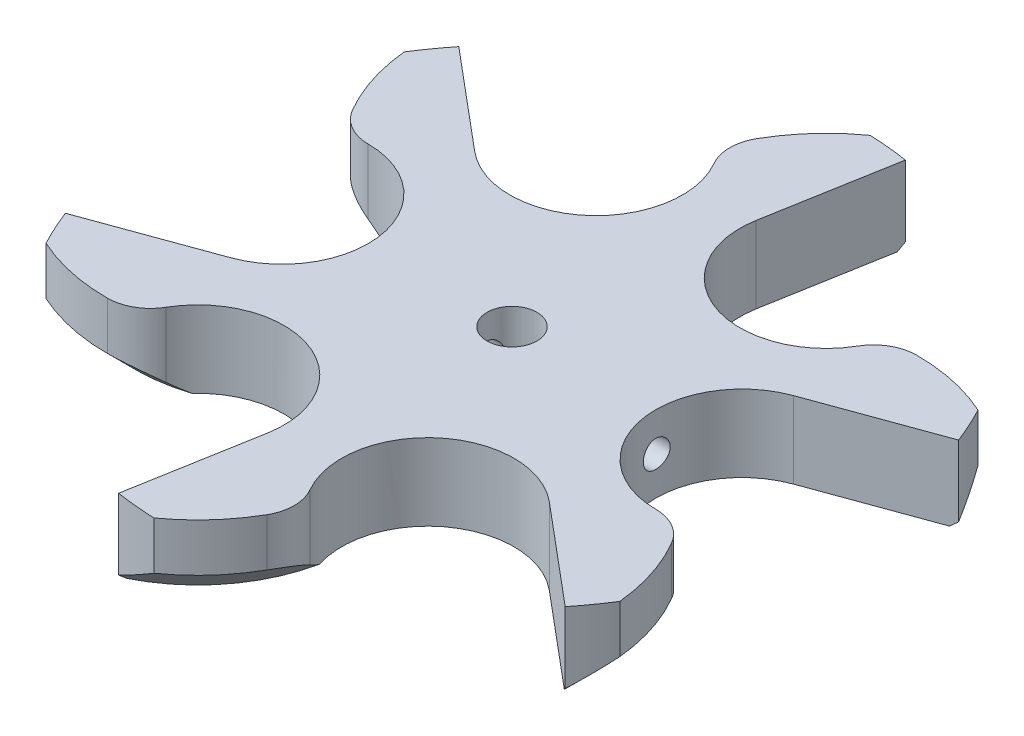
from build123d import *
from build123d.topology import SkipClean

# Parameters (mm, degrees)
EXTRUDE_1_OUTLINE_R      = 2.6
EXTRUDE_1_DEPTH          = 8
CUT_EXTRUDE_1_DEPTH      = 50.836100116
CUT_EXTRUDE_1_DEPTH_BACK = 50.836100116
SKETCH_2_R               = 1.4
EXTRUDE_START            = 1
SKETCH_3_R               = 4
SKETCH_3_R_2             = 2.6
EXTRUDE_2_DEPTH          = 1
FILLET_1_R               = 3
CHAMFER_1_SIZE           = 3


# Read off the part's stored shape, not the designer's step: 凸台-拉伸1
with BuildPart() as part:
    # 凸台-拉伸1 outline → 凸台-拉伸1 (new body)
    with BuildSketch(Plane(origin=(0, 0, 0), x_dir=(1, 0, 0), z_dir=(0, 1, 0))):
        with BuildLine():
            ThreePointArc((-27.888081975, 11.234427543), (-26.242200252, 9.598392892), (-24, 9))
            ThreePointArc((-24, 9), (-15.136730223, 1.562833599), (-20.92181871, -8.457233587))
            Line((-20.92181871, -8.457233587), (-33.550042142, -13.053531028))
            ThreePointArc((-33.550042142, -13.053531028), (-32.755177906, -14.936476169), (-31.854736566, -16.771277779))
            ThreePointArc((-31.854736566, -16.771277779), (-27.859752737, -18.097023194), (-23.673340637, -18.534573681))
            ThreePointArc((-23.673340637, -18.534573681), (-21.433552206, -17.927215624), (-19.794228634, -16.284609691))
            ThreePointArc((-19.794228634, -16.284609691), (-8.92181871, -12.327376104), (-3.136730223, -22.34744329))
            Line((-3.136730223, -22.34744329), (-5.470331592, -35.581954307))
            ThreePointArc((-5.470331592, -35.581954307), (-3.442221148, -35.835054257), (-1.403015673, -35.972649986))
            ThreePointArc((-1.403015673, -35.972649986), (1.742605451, -33.17576521), (4.214741338, -29.769001224))
            ThreePointArc((4.214741338, -29.769001224), (4.808648047, -27.525608515), (4.205771366, -25.284609691))
            ThreePointArc((4.205771366, -25.284609691), (6.214911513, -13.890209703), (17.785088487, -13.890209703))
            Line((17.785088487, -13.890209703), (28.07971055, -22.528423279))
            ThreePointArc((28.07971055, -22.528423279), (29.312956758, -20.898578088), (30.451720893, -19.201372207))
            ThreePointArc((30.451720893, -19.201372207), (29.602358188, -15.078742016), (27.888081975, -11.234427543))
            ThreePointArc((27.888081975, -11.234427543), (26.242200252, -9.598392892), (24, -9))
            ThreePointArc((24, -9), (15.136730223, -1.562833599), (20.92181871, 8.457233587))
            Line((20.92181871, 8.457233587), (33.550042142, 13.053531028))
            ThreePointArc((33.550042142, 13.053531028), (32.755177906, 14.936476169), (31.854736566, 16.771277779))
            ThreePointArc((31.854736566, 16.771277779), (27.859752737, 18.097023194), (23.673340637, 18.534573681))
            ThreePointArc((23.673340637, 18.534573681), (21.433552206, 17.927215624), (19.794228634, 16.284609691))
            ThreePointArc((19.794228634, 16.284609691), (8.92181871, 12.327376104), (3.136730223, 22.34744329))
            Line((3.136730223, 22.34744329), (5.470331592, 35.581954307))
            ThreePointArc((5.470331592, 35.581954307), (3.442221148, 35.835054257), (1.403015673, 35.972649986))
            ThreePointArc((1.403015673, 35.972649986), (-1.742605451, 33.17576521), (-4.214741338, 29.769001224))
            ThreePointArc((-4.214741338, 29.769001224), (-4.808648047, 27.525608515), (-4.205771366, 25.284609691))
            ThreePointArc((-4.205771366, 25.284609691), (-6.214911513, 13.890209703), (-17.785088487, 13.890209703))
            Line((-17.785088487, 13.890209703), (-28.07971055, 22.528423279))
            ThreePointArc((-28.07971055, 22.528423279), (-29.312956758, 20.898578088), (-30.451720893, 19.201372207))
            ThreePointArc((-30.451720893, 19.201372207), (-29.602358188, 15.078742016), (-27.888081975, 11.234427543))
        make_face()
        Circle(EXTRUDE_1_OUTLINE_R, mode=Mode.SUBTRACT)
    extrude(amount=EXTRUDE_1_DEPTH)

    # 草图2 → 切除-拉伸1 (cut, two sides: drawn at the far end of the back side and taken through both)
    with BuildSketch(Plane(origin=(0, 0, 0), x_dir=(0, 0, -1), z_dir=(1, 0, 0)).offset(-CUT_EXTRUDE_1_DEPTH_BACK)):
        with Locations((0, 4)):
            Circle(SKETCH_2_R)
    extrude(amount=CUT_EXTRUDE_1_DEPTH + CUT_EXTRUDE_1_DEPTH_BACK, mode=Mode.SUBTRACT)

    # 草图3 → 凸台-拉伸2 (add)
    with SkipClean():  # the faces are left unmerged after this step: merging them gives an invalid solid
        with BuildSketch(Plane.XZ.offset(EXTRUDE_START)):
            with Locations(Location((0, 0, 0), (0, 0, 90))):
                Circle(SKETCH_3_R)
            with Locations(Location((0, 0, 0), (0, 0, 270))):
                Circle(SKETCH_3_R_2, mode=Mode.SUBTRACT)
        extrude(amount=-EXTRUDE_2_DEPTH)

    # 圆角1
    # the kernel refuses this fillet: 3 mm, written as the material it adds along each edge
    with BuildSketch(Plane(origin=(0, 0, 0), x_dir=(0, 0, 1), z_dir=(1, 0, 0))) as fillet_1_piece_1:
        with BuildLine():
            CenterArc((6.236067977, 3), FILLET_1_R, 221.810314896, 48.189685104)
            Line((4, 1), (3.95527864, 0.96))
            ThreePointArc((3.95527864, 0.96), (3.94, 0.5), (3.94, 0))
            Line((3.94, 0), (4, -0.06))
            Line((4, -0.06), (6.236067977, -0.06))
            Line((6.236067977, -0.06), (6.236067977, 0))
        make_face()
    revolve(axis=Axis((0, 0, 0), (0, -1, 0)))

    # 倒角1
    # the kernel refuses this chamfer: 3 mm, written as the material it takes off along each edge
    with BuildSketch(Plane(origin=(-23.751350664, 0, -0.965270296), x_dir=(-0.7340128901584542, 0, 0.6791355366060836), z_dir=(-0.6791355366060836, 0, -0.7340128901584542))) as chamfer_1_piece_1:
        Polygon((19.500000018 - CHAMFER_1_SIZE, 0), (19.500000018, CHAMFER_1_SIZE), (19.500000018, 0), align=None)
    revolve(axis=Axis((-23.751350664, 0, -0.965270296), (0, 1, 0)), revolution_arc=70.122480661, mode=Mode.SUBTRACT)
    with BuildSketch(Plane(origin=(-11.039726758, 0, -21.051908187), x_dir=(-0.9551550721197726, 0, -0.29610604216035863), z_dir=(0.29610604216035863, 0, -0.9551550721197726))) as chamfer_1_piece_2:
        Polygon((19.499999992 - CHAMFER_1_SIZE, 0), (19.499999992, CHAMFER_1_SIZE), (19.499999992, 0), align=None)
    revolve(axis=Axis((-11.039726758, 0, -21.051908187), (0, 1, 0)), revolution_arc=70.122480753, mode=Mode.SUBTRACT)
    with BuildSketch(Plane(origin=(12.711623912, 0, -20.086637915), x_dir=(-0.2211421814618006, 0, -0.9752415780606957), z_dir=(0.9752415780606957, 0, -0.2211421814618006))) as chamfer_1_piece_3:
        Polygon((19.499999996 - CHAMFER_1_SIZE, 0), (19.499999996, CHAMFER_1_SIZE), (19.499999996, 0), align=None)
    revolve(axis=Axis((12.711623912, 0, -20.086637915), (0, 1, 0)), revolution_arc=70.122480742, mode=Mode.SUBTRACT)
    with BuildSketch(Plane(origin=(23.751350664, 0, 0.965270296), x_dir=(0.7340128901584542, 0, -0.6791355366060836), z_dir=(0.6791355366060836, 0, 0.7340128901584542))) as chamfer_1_piece_4:
        Polygon((19.500000018 - CHAMFER_1_SIZE, 0), (19.500000018, CHAMFER_1_SIZE), (19.500000018, 0), align=None)
    revolve(axis=Axis((23.751350664, 0, 0.965270296), (0, 1, 0)), revolution_arc=70.122480661, mode=Mode.SUBTRACT)
    with BuildSketch(Plane(origin=(11.039726758, 0, 21.051908187), x_dir=(0.9551550721197726, 0, 0.29610604216035863), z_dir=(-0.29610604216035863, 0, 0.9551550721197726))) as chamfer_1_piece_5:
        Polygon((19.499999992 - CHAMFER_1_SIZE, 0), (19.499999992, CHAMFER_1_SIZE), (19.499999992, 0), align=None)
    revolve(axis=Axis((11.039726758, 0, 21.051908187), (0, 1, 0)), revolution_arc=70.122480753, mode=Mode.SUBTRACT)
    with BuildSketch(Plane(origin=(-12.711623912, 0, 20.086637915), x_dir=(0.2211421814618006, 0, 0.9752415780606957), z_dir=(-0.9752415780606957, 0, 0.2211421814618006))) as chamfer_1_piece_6:
        Polygon((19.499999996 - CHAMFER_1_SIZE, 0), (19.499999996, CHAMFER_1_SIZE), (19.499999996, 0), align=None)
    revolve(axis=Axis((-12.711623912, 0, 20.086637915), (0, 1, 0)), revolution_arc=70.122480742, mode=Mode.SUBTRACT)


solid = part.part
